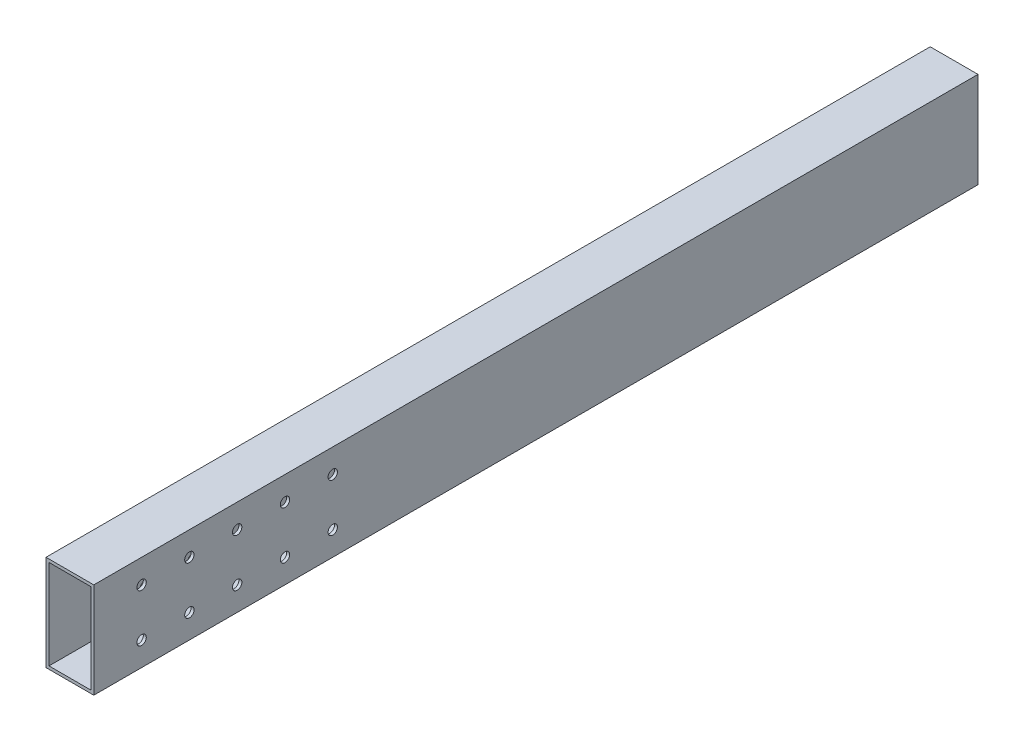
from build123d import *

# Parameters (mm, degrees)
SKETCH1_W           = 25.4
SKETCH1_H           = 50.8
SKETCH1_W_2         = 22.225
SKETCH1_H_2         = 47.625
BOSS_EXTRUDE1_DEPTH = 469.9
CUT_EXTRUDE1_REACH  = 475.32
SKETCH2_R           = 2.4892
CUT_EXTRUDE2_REACH  = 475.32
SKETCH3_R           = 14.2875
SKETCH3_R_2         = 2.4892
SKETCH2_3_R         = 2.4892
CUT_EXTRUDE5_DEPTH  = 474.319986901


with BuildPart() as part:
    # Sketch1 → Boss-Extrude1 (new body)
    with BuildSketch(Plane.XY):
        with Locations((12.7, 25.4)):
            Rectangle(SKETCH1_W, SKETCH1_H)
        with Locations((12.7, 25.4)):
            Rectangle(SKETCH1_W_2, SKETCH1_H_2, mode=Mode.SUBTRACT)
    extrude(amount=BOSS_EXTRUDE1_DEPTH)

    # Sketch2 → Cut-Extrude1 (cut, up to next)
    with BuildSketch(Plane.ZY.offset(-25.4), mode=Mode.PRIVATE) as cut_extrude1_sk1:
        with Locations((368.3, 38.1)):
            Circle(SKETCH2_R)
    cut_extrude1_tool1 = extrude(cut_extrude1_sk1.sketch, amount=CUT_EXTRUDE1_REACH, mode=Mode.PRIVATE) & part.part
    # Sketch2 → Cut-Extrude1 (cut, up to next)
    with BuildSketch(Plane.ZY.offset(-25.4), mode=Mode.PRIVATE) as cut_extrude1_sk2:
        with Locations((342.9, 38.1)):
            Circle(SKETCH2_R)
    cut_extrude1_tool2 = extrude(cut_extrude1_sk2.sketch, amount=CUT_EXTRUDE1_REACH, mode=Mode.PRIVATE) & part.part
    # Sketch2 → Cut-Extrude1 (cut, up to next)
    with BuildSketch(Plane.ZY.offset(-25.4), mode=Mode.PRIVATE) as cut_extrude1_sk3:
        with Locations((368.3, 12.7)):
            Circle(SKETCH2_R)
    cut_extrude1_tool3 = extrude(cut_extrude1_sk3.sketch, amount=CUT_EXTRUDE1_REACH, mode=Mode.PRIVATE) & part.part
    # Sketch2 → Cut-Extrude1 (cut, up to next)
    with BuildSketch(Plane.ZY.offset(-25.4), mode=Mode.PRIVATE) as cut_extrude1_sk4:
        with Locations((342.9, 12.7)):
            Circle(SKETCH2_R)
    cut_extrude1_tool4 = extrude(cut_extrude1_sk4.sketch, amount=CUT_EXTRUDE1_REACH, mode=Mode.PRIVATE) & part.part
    add(cut_extrude1_tool1.solids().sort_by_distance((25.4, 38.1, 368.3))[0], mode=Mode.SUBTRACT)
    add(cut_extrude1_tool2.solids().sort_by_distance((25.4, 38.1, 342.9))[0], mode=Mode.SUBTRACT)
    add(cut_extrude1_tool3.solids().sort_by_distance((25.4, 12.7, 368.3))[0], mode=Mode.SUBTRACT)
    add(cut_extrude1_tool4.solids().sort_by_distance((25.4, 12.7, 342.9))[0], mode=Mode.SUBTRACT)

    # Sketch3 → Cut-Extrude2 (cut, up to next)
    with BuildSketch(Plane.ZY, mode=Mode.PRIVATE) as cut_extrude2_sk1:
        with Locations((114.3, 25.4)):
            Circle(SKETCH3_R)
    cut_extrude2_tool1 = extrude(cut_extrude2_sk1.sketch, amount=-CUT_EXTRUDE2_REACH, mode=Mode.PRIVATE) & part.part
    # Sketch3 → Cut-Extrude2 (cut, up to next)
    with BuildSketch(Plane.ZY, mode=Mode.PRIVATE) as cut_extrude2_sk2:
        with Locations((139.7, 44.45)):
            Circle(SKETCH3_R_2)
    cut_extrude2_tool2 = extrude(cut_extrude2_sk2.sketch, amount=-CUT_EXTRUDE2_REACH, mode=Mode.PRIVATE) & part.part
    # Sketch3 → Cut-Extrude2 (cut, up to next)
    with BuildSketch(Plane.ZY, mode=Mode.PRIVATE) as cut_extrude2_sk3:
        with Locations((88.9, 44.45)):
            Circle(SKETCH3_R_2)
    cut_extrude2_tool3 = extrude(cut_extrude2_sk3.sketch, amount=-CUT_EXTRUDE2_REACH, mode=Mode.PRIVATE) & part.part
    # Sketch3 → Cut-Extrude2 (cut, up to next)
    with BuildSketch(Plane.ZY, mode=Mode.PRIVATE) as cut_extrude2_sk4:
        with Locations((88.9, 6.35)):
            Circle(SKETCH3_R_2)
    cut_extrude2_tool4 = extrude(cut_extrude2_sk4.sketch, amount=-CUT_EXTRUDE2_REACH, mode=Mode.PRIVATE) & part.part
    # Sketch3 → Cut-Extrude2 (cut, up to next)
    with BuildSketch(Plane.ZY, mode=Mode.PRIVATE) as cut_extrude2_sk5:
        with Locations((139.7, 6.35)):
            Circle(SKETCH3_R_2)
    cut_extrude2_tool5 = extrude(cut_extrude2_sk5.sketch, amount=-CUT_EXTRUDE2_REACH, mode=Mode.PRIVATE) & part.part
    add(cut_extrude2_tool1.solids().sort_by_distance((0, 25.4, 114.3))[0], mode=Mode.SUBTRACT)
    add(cut_extrude2_tool2.solids().sort_by_distance((0, 44.45, 139.7))[0], mode=Mode.SUBTRACT)
    add(cut_extrude2_tool3.solids().sort_by_distance((0, 44.45, 88.9))[0], mode=Mode.SUBTRACT)
    add(cut_extrude2_tool4.solids().sort_by_distance((0, 6.35, 88.9))[0], mode=Mode.SUBTRACT)
    add(cut_extrude2_tool5.solids().sort_by_distance((0, 6.35, 139.7))[0], mode=Mode.SUBTRACT)

    # Sketch2<3> → Cut-Extrude5 (cut, through all)
    with BuildSketch(Plane.ZY.offset(-25.4)):
        with Locations((419.1, 38.1)):
            Circle(SKETCH2_3_R)
        with Locations((393.7, 38.1)):
            Circle(SKETCH2_3_R)
        with Locations((419.1, 12.7)):
            Circle(SKETCH2_3_R)
        with Locations((393.7, 12.7)):
            Circle(SKETCH2_3_R)
        with Locations((444.5, 12.7)):
            Circle(SKETCH2_3_R)
        with Locations((444.5, 38.1)):
            Circle(SKETCH2_3_R)
    extrude(amount=CUT_EXTRUDE5_DEPTH, mode=Mode.SUBTRACT)


solid = part.part
